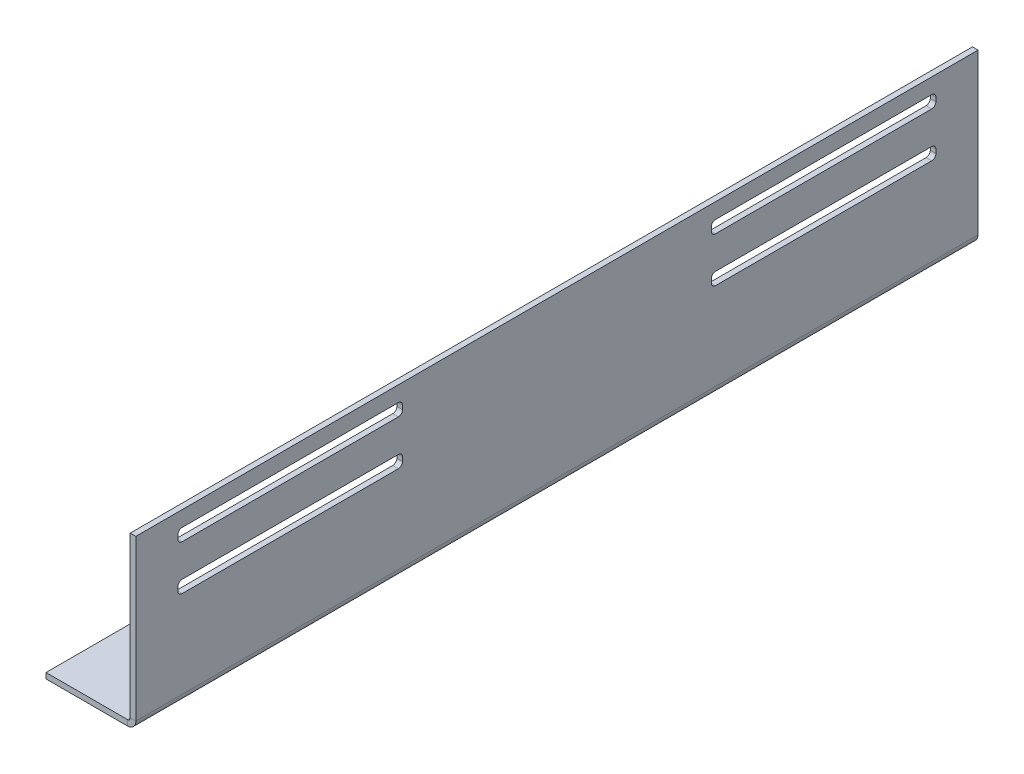
from build123d import *

# Parameters (mm, degrees)
SKETCH1_W                    = 30
SKETCH1_H                    = 300
BASE_FLANGE1_DEPTH           = 2
EDGE_FLANGE1_STRIP_W         = 10
EDGE_FLANGE1_STRIP_H         = 2
EDGE_FLANGE1_STRIP_CUT_DEPTH = 300
EDGE_FLANGE1_DEPTH           = 300
CUT_EXTRUDE1_REACH           = 419.843
SKETCH8_W                    = 80
SKETCH8_H                    = 4.4
FILLET1_R                    = 1.5


# Sheet-metal steps are written as plain solids
with BuildPart() as part:
    # Sketch1 → Base-Flange1 (new body)
    with BuildSketch(Plane(origin=(0, -95.475928118, 0), x_dir=(1, 0, 0), z_dir=(0, 1, 0))):
        with Locations((-31.886491489, -255.528293106)):
            Rectangle(SKETCH1_W, SKETCH1_H)
    extrude(amount=BASE_FLANGE1_DEPTH)

    # Edge-Flange1 strip (across the edge) → Edge-Flange1 strip cut (cut)
    with BuildSketch(Plane(origin=(-16.886491489, -93.475928118, 405.528293106), x_dir=(-1, 0, 0), z_dir=(0, 0, -1))):
        with Locations((-4, -1)):
            Rectangle(EDGE_FLANGE1_STRIP_W, EDGE_FLANGE1_STRIP_H)
    extrude(amount=EDGE_FLANGE1_STRIP_CUT_DEPTH, mode=Mode.SUBTRACT)

    # Edge-Flange1 section (across the edge) → Edge-Flange1 (add)
    with BuildSketch(Plane(origin=(-16.886491489, -93.475928118, 405.528293106), x_dir=(-1, 0, 0), z_dir=(0, 0, -1))):
        with BuildLine():
            Line((-2, 1), (-2, 58))
            Line((-2, 58), (0, 58))
            Line((0, 58), (0, 1))
            ThreePointArc((0, 1), (0.292893219, 0.292893219), (1, 0))
            Line((1, 0), (1, -2))
            ThreePointArc((1, -2), (-1.121320344, -1.121320344), (-2, 1))
        make_face()
    extrude(amount=EDGE_FLANGE1_DEPTH)

    # Sketch8 → Cut-Extrude1 (cut, up to next)
    with BuildSketch(Plane(origin=(-14.886491489, 0, 0), x_dir=(0, 0, -1), z_dir=(1, 0, 0)), mode=Mode.PRIVATE) as cut_extrude1_sk1:
        with Locations((-160.528293106, -43.175928118)):
            Rectangle(SKETCH8_W, SKETCH8_H)
    cut_extrude1_tool1 = extrude(cut_extrude1_sk1.sketch, amount=-CUT_EXTRUDE1_REACH, mode=Mode.PRIVATE) & part.part
    # Sketch8 → Cut-Extrude1 (cut, up to next)
    with BuildSketch(Plane(origin=(-14.886491489, 0, 0), x_dir=(0, 0, -1), z_dir=(1, 0, 0)), mode=Mode.PRIVATE) as cut_extrude1_sk2:
        with Locations((-160.528293106, -59.175928118)):
            Rectangle(SKETCH8_W, SKETCH8_H)
    cut_extrude1_tool2 = extrude(cut_extrude1_sk2.sketch, amount=-CUT_EXTRUDE1_REACH, mode=Mode.PRIVATE) & part.part
    # Sketch8 → Cut-Extrude1 (cut, up to next)
    with BuildSketch(Plane(origin=(-14.886491489, 0, 0), x_dir=(0, 0, -1), z_dir=(1, 0, 0)), mode=Mode.PRIVATE) as cut_extrude1_sk3:
        with Locations((-350.528293106, -43.175928118)):
            Rectangle(SKETCH8_W, SKETCH8_H)
    cut_extrude1_tool3 = extrude(cut_extrude1_sk3.sketch, amount=-CUT_EXTRUDE1_REACH, mode=Mode.PRIVATE) & part.part
    # Sketch8 → Cut-Extrude1 (cut, up to next)
    with BuildSketch(Plane(origin=(-14.886491489, 0, 0), x_dir=(0, 0, -1), z_dir=(1, 0, 0)), mode=Mode.PRIVATE) as cut_extrude1_sk4:
        with Locations((-350.528293106, -59.175928118)):
            Rectangle(SKETCH8_W, SKETCH8_H)
    cut_extrude1_tool4 = extrude(cut_extrude1_sk4.sketch, amount=-CUT_EXTRUDE1_REACH, mode=Mode.PRIVATE) & part.part
    add(cut_extrude1_tool1.solids().sort_by_distance((-14.886491, -43.175928, 160.528293))[0], mode=Mode.SUBTRACT)
    add(cut_extrude1_tool2.solids().sort_by_distance((-14.886491, -59.175928, 160.528293))[0], mode=Mode.SUBTRACT)
    add(cut_extrude1_tool3.solids().sort_by_distance((-14.886491, -43.175928, 350.528293))[0], mode=Mode.SUBTRACT)
    add(cut_extrude1_tool4.solids().sort_by_distance((-14.886491, -59.175928, 350.528293))[0], mode=Mode.SUBTRACT)

    # Fillet1
    fillet1_edges = [part.edges().sort_by_distance(p)[0] for p in [
        (-15.886491489, -40.975928118, 120.528293106),
        (-15.886491489, -45.375928118, 120.528293106),
        (-15.886491489, -45.375928118, 200.528293106),
        (-15.886491489, -40.975928118, 200.528293106),
        (-15.886491489, -56.975928118, 120.528293106),
        (-15.886491489, -61.375928118, 120.528293106),
        (-15.886491489, -61.375928118, 200.528293106),
        (-15.886491489, -56.975928118, 200.528293106),
        (-15.886491489, -45.375928118, 390.528293106),
        (-15.886491489, -40.975928118, 390.528293106),
        (-15.886491489, -40.975928118, 310.528293106),
        (-15.886491489, -45.375928118, 310.528293106),
        (-15.886491489, -61.375928118, 390.528293106),
        (-15.886491489, -56.975928118, 390.528293106),
        (-15.886491489, -56.975928118, 310.528293106),
        (-15.886491489, -61.375928118, 310.528293106),
    ]]
    fillet(fillet1_edges, radius=FILLET1_R)


solid = part.part
